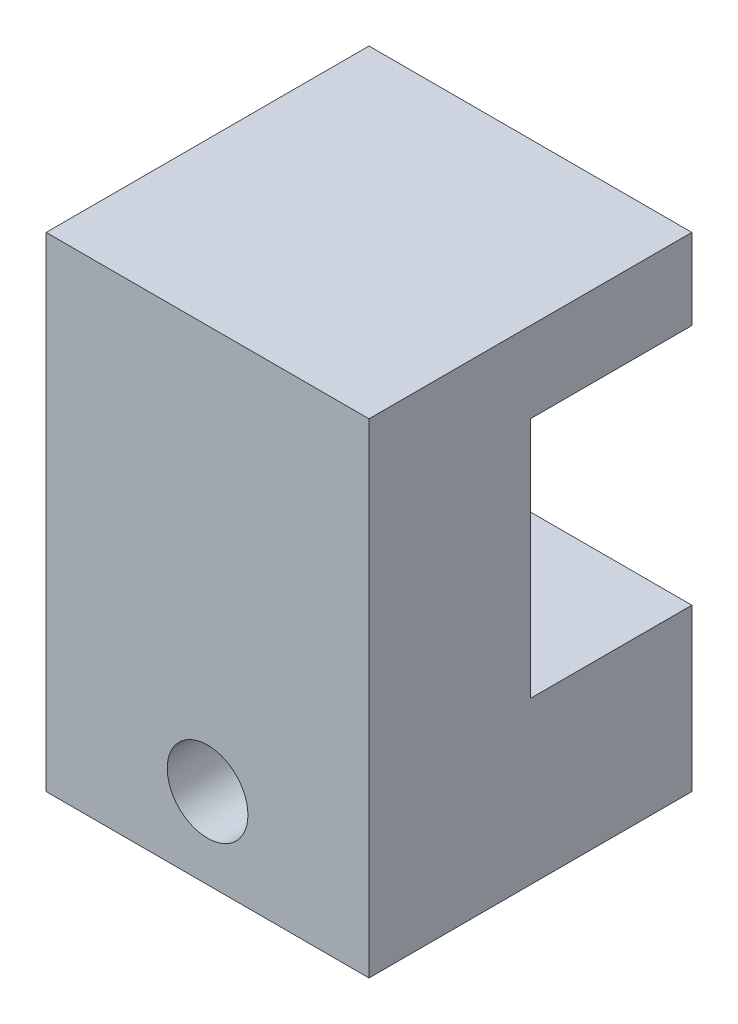
from build123d import *

# Parameters (mm, degrees)
SKETCH1_W           = 25.4
SKETCH1_H           = 38.1
BOSS_EXTRUDE1_DEPTH = 12.7
SKETCH2_W           = 25.4
SKETCH2_H           = 19.05
CUT_EXTRUDE1_DEPTH  = 12.7
SKETCH3_R           = 3.175
CUT_EXTRUDE2_DEPTH  = 35.195796525


with BuildPart() as part:
    # Sketch1 → Boss-Extrude1 (new, symmetric)
    with BuildSketch(Plane.XY):
        Rectangle(SKETCH1_W, SKETCH1_H)
    extrude(amount=BOSS_EXTRUDE1_DEPTH, both=True)

    # Sketch2 → Cut-Extrude1 (cut)
    with BuildSketch(Plane(origin=(0, 0, -12.7), x_dir=(-1, 0, 0), z_dir=(0, 0, -1))):
        with Locations((0, 3.175)):
            Rectangle(SKETCH2_W, SKETCH2_H)
    extrude(amount=-CUT_EXTRUDE1_DEPTH, mode=Mode.SUBTRACT)

    # Sketch3 → Cut-Extrude2 (cut, through all)
    with BuildSketch(Plane.XY.offset(12.7)):
        with Locations((0, -12.7)):
            Circle(SKETCH3_R)
    extrude(amount=-CUT_EXTRUDE2_DEPTH, mode=Mode.SUBTRACT)


solid = part.part
